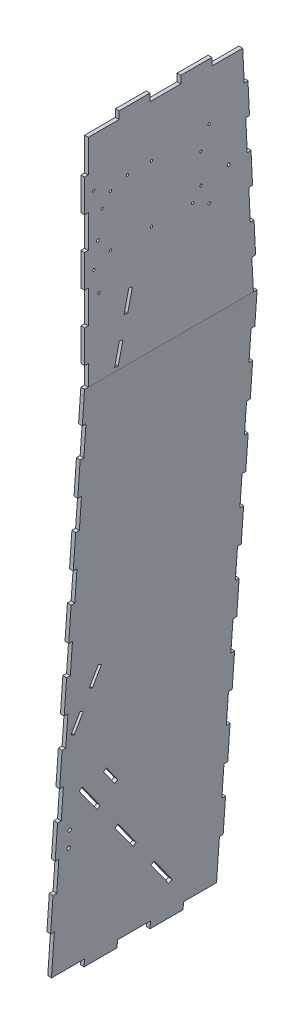
from build123d import *

# Parameters (mm, degrees)
BOSS_EXTRUDE1_DEPTH      = 469.9
SKETCH2_W                = 10.16
SKETCH2_H                = 83.651125112
SKETCH2_H_2              = 83.677721465
SKETCH2_H_3              = 83.704317819
SKETCH2_H_4              = 83.730914172
SKETCH2_H_5              = 83.757510526
SKETCH2_H_6              = 83.784106879
SKETCH2_H_7              = 83.810703233
SKETCH2_H_8              = 133.264269193
CUT_EXTRUDE1_DEPTH       = 10.16
SKETCH3_W                = 10.16
SKETCH3_H                = 55.879999965
SKETCH3_H_2              = 88.9
SKETCH3_H_3              = 109.22
CUT_EXTRUDE2_DEPTH       = 12.7
SKETCH4_W                = 84.113540858
SKETCH4_H                = 20.32
CUT_EXTRUDE3_DEPTH       = 12.7
SKETCH5_W                = 89.916
SKETCH5_H                = 20.32
CUT_EXTRUDE4_DEPTH       = 12.7
SKETCH13_R               = 3.175
CUT_EXTRUDE8_DEPTH       = 2128.667464702
CUT_EXTRUDE9_DEPTH       = 2128.667464702
SKETCH20_R               = 4.7625
CUT_EXTRUDE10_DEPTH      = 2107.728843747
SKETCH24_R               = 3.175
CUT_EXTRUDE12_DEPTH      = 12.7
CUT_EXTRUDE13_DEPTH      = 2128.667464702
CUT_EXTRUDE13_DEPTH_BACK = 2128.667464702
SKETCH30_R               = 4
CUT_EXTRUDE16_DEPTH      = 18


with BuildPart() as part:
    # Sketch1 → Boss-Extrude1 (new body)
    with BuildSketch(Plane.XY):
        Polygon((-215.881789204, 2052.32), (-215.881789204, 1463.040000035), (-316.088635901, 20.32), (-317.499999939, 0), (-307.333509538, 0), (-205.715298803, 1463.040000035), (-205.715298803, 2072.64), (-215.881789204, 2072.64), align=None)
    extrude(amount=-BOSS_EXTRUDE1_DEPTH)

    # Sketch2 → Cut-Extrude1 (cut)
    with BuildSketch(Plane(origin=(-315.975651309, 21.946686571, 0), x_dir=(0, 0, 1), z_dir=(-0.9975965627192115, 0.06928995634877068, 0))):
        with Locations((-464.82, 1313.852971026)):
            Rectangle(SKETCH2_W, SKETCH2_H)
        with Locations((-464.82, 1136.066269203)):
            Rectangle(SKETCH2_W, SKETCH2_H_2)
        with Locations((-464.82, 958.27956738)):
            Rectangle(SKETCH2_W, SKETCH2_H_3)
        with Locations((-464.82, 780.492865556)):
            Rectangle(SKETCH2_W, SKETCH2_H_4)
        with Locations((-464.82, 602.706163733)):
            Rectangle(SKETCH2_W, SKETCH2_H_5)
        with Locations((-464.82, 424.91946191)):
            Rectangle(SKETCH2_W, SKETCH2_H_6)
        with Locations((-464.82, 247.132760087)):
            Rectangle(SKETCH2_W, SKETCH2_H_7)
        with Locations((-464.82, 44.63257346)):
            Rectangle(SKETCH2_W, SKETCH2_H_8)
        with Locations((-5.08, 44.63257346)):
            Rectangle(SKETCH2_W, SKETCH2_H_8)
        with Locations((-5.08, 247.132760087)):
            Rectangle(SKETCH2_W, SKETCH2_H_7)
        with Locations((-5.08, 424.91946191)):
            Rectangle(SKETCH2_W, SKETCH2_H_6)
        with Locations((-5.08, 602.706163733)):
            Rectangle(SKETCH2_W, SKETCH2_H_5)
        with Locations((-5.08, 780.492865556)):
            Rectangle(SKETCH2_W, SKETCH2_H_4)
        with Locations((-5.08, 958.27956738)):
            Rectangle(SKETCH2_W, SKETCH2_H_3)
        with Locations((-5.08, 1136.066269203)):
            Rectangle(SKETCH2_W, SKETCH2_H_2)
        with Locations((-5.08, 1313.852971026)):
            Rectangle(SKETCH2_W, SKETCH2_H)
    extrude(amount=-CUT_EXTRUDE1_DEPTH, mode=Mode.SUBTRACT)

    # Sketch3 → Cut-Extrude2 (cut)
    with BuildSketch(Plane.ZY.offset(215.881789204)):
        with Locations((-5.08, 1490.980000018)):
            Rectangle(SKETCH3_W, SKETCH3_H)
        with Locations((-5.08, 1652.27)):
            Rectangle(SKETCH3_W, SKETCH3_H_2)
        Polygon((-469.9, 1463.040000035), (-459.727704291, 1463.040000035), (-455.605912768, 1546.794803777), (-465.753631921, 1547.294199405), (-461.607263841, 1631.548398775), (-451.459544688, 1631.049003148), (-447.313176609, 1715.303202518), (-457.460895762, 1715.802598146), (-453.314527682, 1800.056797516), (-443.166808529, 1799.557401889), (-439.02044045, 1883.811601259), (-449.168159603, 1884.310996887), (-445.021791523, 1968.565196257), (-434.87407237, 1968.06580063), (-429.727704291, 2072.64), (-469.9, 2072.64), align=None)
        with Locations((-5.08, 1830.07)):
            Rectangle(SKETCH3_W, SKETCH3_H_2)
        with Locations((-5.08, 2018.03)):
            Rectangle(SKETCH3_W, SKETCH3_H_3)
    extrude(amount=-CUT_EXTRUDE2_DEPTH, mode=Mode.SUBTRACT)

    # Sketch4 → Cut-Extrude3 (cut)
    with BuildSketch(Plane.ZY.offset(215.881789204)):
        with Locations((-388.670933862, 2062.48)):
            Rectangle(SKETCH4_W, SKETCH4_H)
        with Locations((-220.443852145, 2062.48)):
            Rectangle(SKETCH4_W, SKETCH4_H)
        with Locations((-52.216770429, 2062.48)):
            Rectangle(SKETCH4_W, SKETCH4_H)
    extrude(amount=-CUT_EXTRUDE3_DEPTH, mode=Mode.SUBTRACT)

    # Sketch5 → Cut-Extrude4 (cut)
    with BuildSketch(Plane(origin=(-315.975651309, 21.946686571, 0), x_dir=(0, 0, 1), z_dir=(-0.9975965627192115, 0.06928995634877068, 0))):
        with Locations((-414.782, -11.839561137)):
            Rectangle(SKETCH5_W, SKETCH5_H)
        with Locations((-234.95, -11.839561137)):
            Rectangle(SKETCH5_W, SKETCH5_H)
        with Locations((-55.118, -11.839561137)):
            Rectangle(SKETCH5_W, SKETCH5_H)
    extrude(amount=-CUT_EXTRUDE4_DEPTH, mode=Mode.SUBTRACT)

    # Sketch13 → Cut-Extrude8 (cut, through all)
    with BuildSketch(Plane.ZY.offset(215.881789204)):
        with Locations((-25.246459893, 1731.87)):
            Circle(SKETCH13_R)
        with Locations((-70.408959893, 1755.42)):
            Circle(SKETCH13_R)
        with Locations((-182.408959893, 1755.42)):
            Circle(SKETCH13_R)
        with Locations((-25.246459893, 1918.97)):
            Circle(SKETCH13_R)
        with Locations((-47.788959893, 1865.42)):
            Circle(SKETCH13_R)
        with Locations((-182.408959893, 1910.42)):
            Circle(SKETCH13_R)
        with Locations((-117.078959893, 1910.42)):
            Circle(SKETCH13_R)
        with Locations((-70.408959893, 1895.42)):
            Circle(SKETCH13_R)
        with Locations((-317.028959893, 1865.42)):
            Circle(SKETCH13_R)
        with Locations((-294.408959893, 1755.42)):
            Circle(SKETCH13_R)
        with Locations((-317.028959893, 1785.42)):
            Circle(SKETCH13_R)
        with Locations((-339.571459893, 1731.87)):
            Circle(SKETCH13_R)
        with Locations((-339.571459893, 1918.97)):
            Circle(SKETCH13_R)
    extrude(amount=-CUT_EXTRUDE8_DEPTH, mode=Mode.SUBTRACT)

    # Sketch17 → Cut-Extrude9 (cut, through all)
    with BuildSketch(Plane.ZY.offset(215.881789204)):
        Polygon((-120.524654614, 1641.945974367), (-130.424254473, 1639.660471655), (-117.483615058, 1583.608404231), (-107.584015199, 1585.893906943), align=None)
        Polygon((-94.643375784, 1529.841839519), (-104.542975642, 1527.556336807), (-91.602336227, 1471.504269383), (-81.702736369, 1473.789772095), align=None)
    extrude(amount=-CUT_EXTRUDE9_DEPTH, mode=Mode.SUBTRACT)

    # Sketch20 → Cut-Extrude10 (cut, through all)
    with BuildSketch(Plane(origin=(-315.975651309, 21.946686571, 0), x_dir=(0, 0, 1), z_dir=(-0.9975965627192116, 0.06928995634876853, 0))):
        Polygon((-128.598334701, 451.361418049), (-162.492565561, 405.347250509), (-154.823537638, 399.698212032), (-120.929306778, 445.712379572), align=None)
        with Locations((-35.56, 347.287639338)):
            Circle(SKETCH20_R)
        with Locations((-35.56, 302.837639338)):
            Circle(SKETCH20_R)
    extrude(amount=-CUT_EXTRUDE10_DEPTH, mode=Mode.SUBTRACT)

    # Sketch24 → Cut-Extrude12 (cut)
    with BuildSketch(Plane.ZY.offset(215.881789204)):
        with Locations((-39.313746491, 1670.454214013)):
            Circle(SKETCH24_R)
    extrude(amount=-CUT_EXTRUDE12_DEPTH, mode=Mode.SUBTRACT)

    # Sketch26 → Cut-Extrude13 (cut, two sides: drawn at the far end of the back side and taken through both)
    with BuildSketch(Plane.ZY.offset(215.881789204).offset(-CUT_EXTRUDE13_DEPTH_BACK)):
        Polygon((-96.478494721, 741.073656933), (-74.89887104, 694.944067742), (-65.68812669, 699.232207156), (-87.26775037, 745.361796346), align=None)
        Polygon((-31.73962368, 602.684889361), (-22.52887933, 606.973028774), (-44.10850301, 653.102617965), (-53.31924736, 648.814478552), align=None)
        Polygon((-63.755697238, 458.569669358), (-117.688081031, 385.528057798), (-109.500847052, 379.511801077), (-55.568463259, 452.553412636), align=None)
        Polygon((-333.417616206, 93.36161156), (-325.230382227, 87.345354838), (-271.297998434, 160.386966398), (-279.485232413, 166.403223119), align=None)
        Polygon((-225.552848619, 239.444834679), (-217.372552167, 233.433675887), (-163.440168374, 306.475287447), (-171.620464825, 312.486446238), align=None)
    extrude(amount=CUT_EXTRUDE13_DEPTH + CUT_EXTRUDE13_DEPTH_BACK, mode=Mode.SUBTRACT)

    # Sketch30 → Cut-Extrude16 (cut)
    with BuildSketch(Plane(origin=(-205.715298803, 0, 0), x_dir=(0, 0, -1), z_dir=(1, 0, 0))):
        with Locations((36.16, 1796.1325)):
            Circle(SKETCH30_R)
        with Locations((392.66, 1796.1325)):
            Circle(SKETCH30_R)
    extrude(amount=-CUT_EXTRUDE16_DEPTH, mode=Mode.SUBTRACT)


solid = part.part
